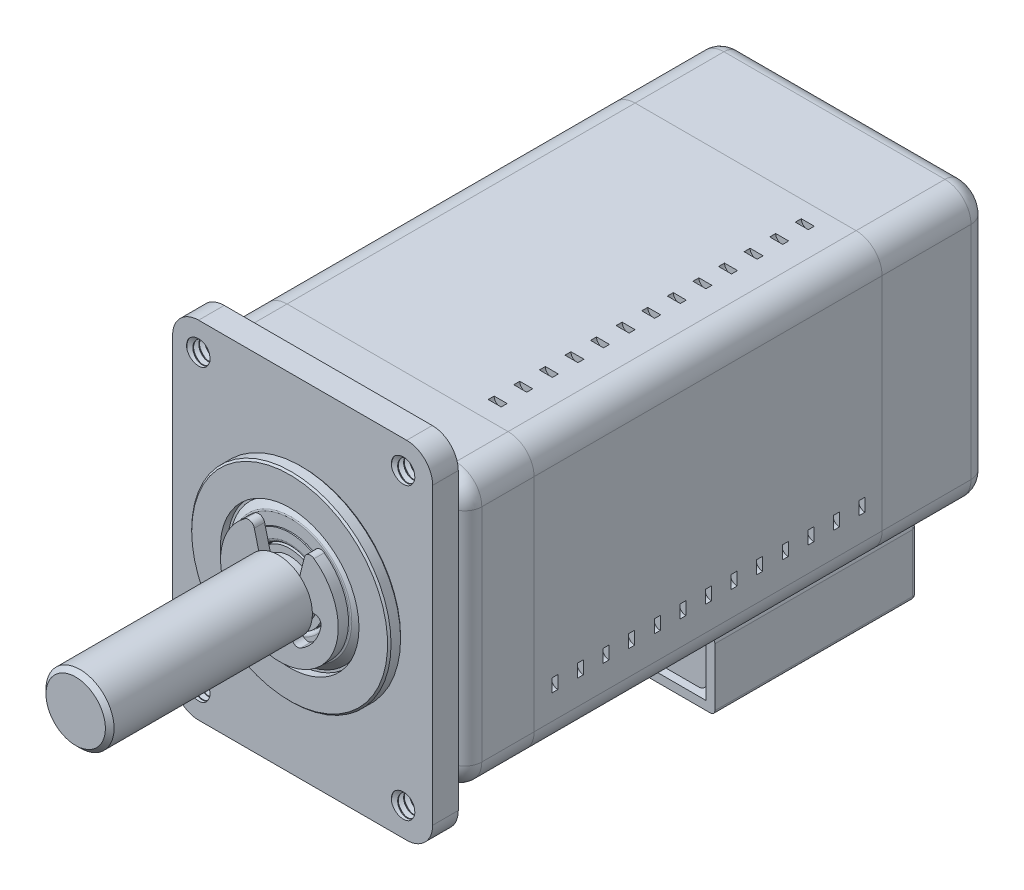
from build123d import *

# Parameters (mm, degrees)
SKETCH3_R                    = 0.8
SKETCH3_R_2                  = 5.08
BOSS_EXTRUDE1_DEPTH          = 1.5
SKETCH4_W                    = 4.064
SKETCH4_H                    = 0.762
CHAMFER1_SIZE                = 0.1016
FILLET1_R                    = 0.2032
FILLET2_R                    = 0.127
CHAMFER2_SIZE                = 0.254
BOSS_EXTRUDE2_DEPTH          = 0.59944
FILLET3_R                    = 0.36068
SKETCH9_W                    = 16
SKETCH9_H                    = 16
SKETCH9_R                    = 5.075
BOSS_EXTRUDE3_DEPTH          = 4.064
FILLET4_R                    = 1.524
FILLET5_R                    = 1
SKETCH10_R                   = 5.075
BOSS_EXTRUDE4_DEPTH          = 6.20776
FILLET6_R                    = 1
BOSS_EXTRUDE5_DEPTH          = 20.39424
CUT_EXTRUDE1_START           = -1
SKETCH13_R                   = 0.381
CUT_EXTRUDE1_DEPTH           = 0.35052
LPATTERN1_COUNT              = 13
LPATTERN1_PITCH              = 1.5
CIRPATTERN1_COUNT            = 4
CIRPATTERN1_START            = -1
CIRPATTERN1_COPY_1_SKETCH_R  = 0.381
CIRPATTERN1_COPY_1_DEPTH     = 0.35052
CIRPATTERN1_COPY_2_SKETCH_R  = 0.381
CIRPATTERN1_COPY_2_DEPTH     = 0.35052
CIRPATTERN1_COPY_3_SKETCH_R  = 0.381
CIRPATTERN1_COPY_3_DEPTH     = 0.35052
CIRPATTERN1_COPY_4_SKETCH_R  = 0.381
CIRPATTERN1_COPY_4_DEPTH     = 0.35052
CIRPATTERN1_COPY_5_SKETCH_R  = 0.381
CIRPATTERN1_COPY_5_DEPTH     = 0.35052
CIRPATTERN1_COPY_6_SKETCH_R  = 0.381
CIRPATTERN1_COPY_6_DEPTH     = 0.35052
CIRPATTERN1_COPY_7_SKETCH_R  = 0.381
CIRPATTERN1_COPY_7_DEPTH     = 0.35052
CIRPATTERN1_COPY_8_SKETCH_R  = 0.381
CIRPATTERN1_COPY_8_DEPTH     = 0.35052
CIRPATTERN1_COPY_9_SKETCH_R  = 0.381
CIRPATTERN1_COPY_9_DEPTH     = 0.35052
CIRPATTERN1_COPY_10_SKETCH_R = 0.381
CIRPATTERN1_COPY_10_DEPTH    = 0.35052
CIRPATTERN1_COPY_11_SKETCH_R = 0.381
CIRPATTERN1_COPY_11_DEPTH    = 0.35052
CIRPATTERN1_COPY_12_SKETCH_R = 0.381
CIRPATTERN1_COPY_12_DEPTH    = 0.35052
CIRPATTERN1_COPY_13_SKETCH_R = 0.381
CIRPATTERN1_COPY_13_DEPTH    = 0.35052
CIRPATTERN1_COPY_14_SKETCH_R = 0.381
CIRPATTERN1_COPY_14_DEPTH    = 0.35052
CIRPATTERN1_COPY_15_SKETCH_R = 0.381
CIRPATTERN1_COPY_15_DEPTH    = 0.35052
CIRPATTERN1_COPY_16_SKETCH_R = 0.381
CIRPATTERN1_COPY_16_DEPTH    = 0.35052
CIRPATTERN1_COPY_17_SKETCH_R = 0.381
CIRPATTERN1_COPY_17_DEPTH    = 0.35052
CIRPATTERN1_COPY_18_SKETCH_R = 0.381
CIRPATTERN1_COPY_18_DEPTH    = 0.35052
CIRPATTERN1_COPY_19_SKETCH_R = 0.381
CIRPATTERN1_COPY_19_DEPTH    = 0.35052
CIRPATTERN1_COPY_20_SKETCH_R = 0.381
CIRPATTERN1_COPY_20_DEPTH    = 0.35052
CIRPATTERN1_COPY_21_SKETCH_R = 0.381
CIRPATTERN1_COPY_21_DEPTH    = 0.35052
CIRPATTERN1_COPY_22_SKETCH_R = 0.381
CIRPATTERN1_COPY_22_DEPTH    = 0.35052
CIRPATTERN1_COPY_23_SKETCH_R = 0.381
CIRPATTERN1_COPY_23_DEPTH    = 0.35052
CIRPATTERN1_COPY_24_SKETCH_R = 0.381
CIRPATTERN1_COPY_24_DEPTH    = 0.35052
CIRPATTERN1_COPY_25_SKETCH_R = 0.381
CIRPATTERN1_COPY_25_DEPTH    = 0.35052
CIRPATTERN1_COPY_26_SKETCH_R = 0.381
CIRPATTERN1_COPY_26_DEPTH    = 0.35052
CIRPATTERN1_COPY_27_SKETCH_R = 0.381
CIRPATTERN1_COPY_27_DEPTH    = 0.35052
CIRPATTERN1_COPY_28_SKETCH_R = 0.381
CIRPATTERN1_COPY_28_DEPTH    = 0.35052
CIRPATTERN1_COPY_29_SKETCH_R = 0.381
CIRPATTERN1_COPY_29_DEPTH    = 0.35052
CIRPATTERN1_COPY_30_SKETCH_R = 0.381
CIRPATTERN1_COPY_30_DEPTH    = 0.35052
CIRPATTERN1_COPY_31_SKETCH_R = 0.381
CIRPATTERN1_COPY_31_DEPTH    = 0.35052
CIRPATTERN1_COPY_32_SKETCH_R = 0.381
CIRPATTERN1_COPY_32_DEPTH    = 0.35052
CIRPATTERN1_COPY_33_SKETCH_R = 0.381
CIRPATTERN1_COPY_33_DEPTH    = 0.35052
CIRPATTERN1_COPY_34_SKETCH_R = 0.381
CIRPATTERN1_COPY_34_DEPTH    = 0.35052
CIRPATTERN1_COPY_35_SKETCH_R = 0.381
CIRPATTERN1_COPY_35_DEPTH    = 0.35052
CIRPATTERN1_COPY_36_SKETCH_R = 0.381
CIRPATTERN1_COPY_36_DEPTH    = 0.35052
SKETCH14_R                   = 2.8575
BOSS_EXTRUDE7_DEPTH          = 0.508
SKETCH15_R                   = 2.25
BOSS_EXTRUDE8_DEPTH          = 1.53
CUT_EXTRUDE2_DEPTH           = 1.05
BOSS_EXTRUDE9_DEPTH          = 7.05
BOSS_EXTRUDE9_DEPTH_BACK     = 7.05
SKETCH19_W                   = 11.84828
SKETCH19_H                   = 3.9
SHELL1_T                     = -0.508
FILLET7_R                    = 0.254
SKETCH20_W                   = 9.017
SKETCH20_H                   = 0.508
CUT_EXTRUDE4_DEPTH           = 3.175
BOSS_EXTRUDE10_START         = -0.254
BOSS_EXTRUDE10_DEPTH         = 2.54
SKETCH22_R                   = 0.4826
BOSS_EXTRUDE11_DEPTH         = 3.81
BOSS_EXTRUDE11_2_DEPTH       = 3.81
BOSS_EXTRUDE11_3_DEPTH       = 3.81
BOSS_EXTRUDE11_4_DEPTH       = 3.81
SWEEP5_PITCH                 = 0.35
SWEEP5_HEIGHT                = 1.85
SWEEP5_RADIUS                = 0.8
SWEEP5_START_ANGLE           = 90
LPATTERN4_COUNT              = 2
LPATTERN4_PITCH              = 17
LPATTERN5_COUNT              = 2
LPATTERN5_PITCH              = 12
CUT_EXTRUDE5_DEPTH           = 38.791945742
CUT_EXTRUDE6_DEPTH           = 37.408558921


# Read off the part's stored shape, not the designer's step: Mirror1
with BuildPart() as part:
    # Sketch3 → Boss-Extrude1 (new body)
    with BuildSketch(Plane.XY.offset(9.433)):
        with BuildLine():
            Line((-6.096, 10.15), (6.096, 10.15))
            ThreePointArc((6.096, 10.15), (7.173630735, 9.703630735), (7.62, 8.626))
            Line((7.62, 8.626), (7.62, -8.626))
            ThreePointArc((7.62, -8.626), (7.173630735, -9.703630735), (6.096, -10.15))
            Line((6.096, -10.15), (-6.096, -10.15))
            ThreePointArc((-6.096, -10.15), (-7.173630735, -9.703630735), (-7.62, -8.626))
            Line((-7.62, -8.626), (-7.62, 8.626))
            ThreePointArc((-7.62, 8.626), (-7.173630735, 9.703630735), (-6.096, 10.15))
        make_face()
        with Locations((6, -8.5)):
            Circle(SKETCH3_R, mode=Mode.SUBTRACT)
        with Locations((6, 8.5)):
            Circle(SKETCH3_R, mode=Mode.SUBTRACT)
        with Locations((-6, 8.5)):
            Circle(SKETCH3_R, mode=Mode.SUBTRACT)
        with Locations((-6, -8.5)):
            Circle(SKETCH3_R, mode=Mode.SUBTRACT)
        Circle(SKETCH3_R_2, mode=Mode.SUBTRACT)
    extrude(amount=-BOSS_EXTRUDE1_DEPTH)


with BuildPart() as body_2:
    # Sketch4 → Revolve1 (revolve)
    with BuildSketch(Plane(origin=(0, 0, 0), x_dir=(0, 0, -1), z_dir=(1, 0, 0)), mode=Mode.PRIVATE) as revolve1_sk:
        Polygon((-6.131, 5.075), (-9.433, 5.075), (-9.433, 5.842), (-10.195, 5.842), (-10.195, 4.064), (-6.131, 4.064), align=None)
        with Locations((-8.163, 2.413)):
            Rectangle(SKETCH4_W, SKETCH4_H)
    revolve(revolve1_sk.sketch.rotate(Axis((0, 0, 22.733), (0, 0, -1)), 90), axis=Axis((0, 0, 22.733), (0, 0, -1)))

    # Chamfer1
    chamfer1_edges = [body_2.edges().sort_by_distance(p)[0] for p in [
        (-5.842, 0, 10.195),
        (-5.842, 0, 9.433),
    ]]
    chamfer(chamfer1_edges, length=CHAMFER1_SIZE)

    # Fillet1
    fillet1_edges = [body_2.edges().sort_by_distance(p)[0] for p in [
        (-2.032, 0, 10.195),
    ]]
    fillet(fillet1_edges, radius=FILLET1_R)


with BuildPart() as body_3:
    # Sketch5 → Revolve2 (revolve)
    with BuildSketch(Plane(origin=(0, 0, 0), x_dir=(0, 0, -1), z_dir=(1, 0, 0)), mode=Mode.PRIVATE) as revolve2_sk:
        Polygon((-10.1188, 3.50012), (-10.1188, 2.794), (-9.39236, 2.794), (-9.39236, 4.064), (-9.75558, 4.064), (-9.75558, 3.93298874), align=None)
    revolve(revolve2_sk.sketch.rotate(Axis((0, 0, 22.733), (0, 0, -1)), 90), axis=Axis((0, 0, 22.733), (0, 0, -1)))

    # Fillet2
    fillet2_edges = [body_3.edges().sort_by_distance(p)[0] for p in [
        (-3.50012, 0, 10.1188),
    ]]
    fillet(fillet2_edges, radius=FILLET2_R)


with BuildPart() as body_4:
    # Sketch6 → Revolve3 (revolve)
    with BuildSketch(Plane(origin=(0, 0, 0), x_dir=(0, 0, -1), z_dir=(1, 0, 0)), mode=Mode.PRIVATE) as revolve3_sk:
        Polygon((-22.733, 0), (-22.733, 1.994), (-10.8554, 1.994), (-10.8554, 1.613), (-10.195, 1.613), (-10.195, 1.994), (22.733, 1.994), (22.733, 0), align=None)
    revolve(revolve3_sk.sketch.rotate(Axis((0, 0, 22.733), (0, 0, -1)), 90), axis=Axis((0, 0, 22.733), (0, 0, -1)))

    # Chamfer2
    chamfer2_edges = [body_4.edges().sort_by_distance(p)[0] for p in [
        (-1.994, 0, -22.733),
        (-1.994, 0, 22.733),
    ]]
    chamfer(chamfer2_edges, length=CHAMFER2_SIZE)


with BuildPart() as body_5:
    # Sketch8 → Boss-Extrude2 (new body)
    with BuildSketch(Plane.XY.offset(10.195)):
        with BuildLine():
            ThreePointArc((-1.5875, 3.062295252), (0, -3.44932), (1.5875, 3.062295252))
            Line((1.5875, 3.062295252), (1.217677431, 1.579017946))
            ThreePointArc((1.217677431, 1.579017946), (1.789425159, 0.879769061), (1.994, 0))
            ThreePointArc((1.994, 0), (1.993999088, -0.001907133), (1.993996352, -0.003814265))
            Line((1.993996352, -0.003814265), (2.476484912, -0.008644598))
            ThreePointArc((2.476484912, -0.008644598), (2.032341842, -1.415146242), (0.86728858, -2.319668677))
            Line((0.86728858, -2.319668677), (0.698313518, -1.867724345))
            ThreePointArc((0.698313518, -1.867724345), (0, -1.994), (-0.698313518, -1.867724345))
            Line((-0.698313518, -1.867724345), (-0.86728858, -2.319668677))
            ThreePointArc((-0.86728858, -2.319668677), (-2.034808642, -1.411596983), (-2.4765, 0))
            Line((-2.4765, 0), (-1.994, 0))
            ThreePointArc((-1.994, 0), (-1.789425159, 0.879769061), (-1.217677431, 1.579017946))
            Line((-1.217677431, 1.579017946), (-1.5875, 3.062295252))
        make_face()
        with BuildLine():
            Line((-1.114670775, 1.16588081), (-1.217677431, 1.579017946))
            ThreePointArc((-1.217677431, 1.579017946), (-1.789425159, 0.879769061), (-1.994, 0))
            Line((-1.994, 0), (-1.613, 0))
            ThreePointArc((-1.613, 0), (-1.483194687, 0.633957822), (-1.114670775, 1.16588081))
        make_face()
        with BuildLine():
            ThreePointArc((-0.698313518, -1.867724345), (0, -1.994), (0.698313518, -1.867724345))
            Line((0.698313518, -1.867724345), (0.564884506, -1.510852241))
            ThreePointArc((0.564884506, -1.510852241), (0, -1.613), (-0.564884506, -1.510852241))
            Line((-0.564884506, -1.510852241), (-0.698313518, -1.867724345))
        make_face()
        with BuildLine():
            ThreePointArc((1.994, 0), (1.789425159, 0.879769061), (1.217677431, 1.579017946))
            Line((1.217677431, 1.579017946), (1.114670775, 1.16588081))
            ThreePointArc((1.114670775, 1.16588081), (1.483194687, 0.633957822), (1.613, 0))
            Line((1.613, 0), (1.993996352, -0.003814265))
            ThreePointArc((1.993996352, -0.003814265), (1.993999088, -0.001907133), (1.994, 0))
        make_face()
    extrude(amount=BOSS_EXTRUDE2_DEPTH)

    # Fillet3
    fillet3_edges = [body_5.edges().sort_by_distance(p)[0] for p in [
        (2.476484912, -0.008644598, 10.49472),
        (1.5875, 3.062295252, 10.49472),
        (-1.5875, 3.062295252, 10.49472),
        (-2.4765, 0, 10.49472),
        (-0.86728858, -2.319668677, 10.49472),
        (0.86728858, -2.319668677, 10.49472),
    ]]
    fillet(fillet3_edges, radius=FILLET3_R)


with BuildPart() as body_6:
    # Sketch9 → Boss-Extrude3 (new body)
    with BuildSketch(Plane(origin=(0, 0, 7.933), x_dir=(-1, 0, 0), z_dir=(0, 0, -1))):
        Rectangle(SKETCH9_W, SKETCH9_H)
        Circle(SKETCH9_R, mode=Mode.SUBTRACT)
    extrude(amount=BOSS_EXTRUDE3_DEPTH)

    # Fillet4
    fillet4_edges = [body_6.edges().sort_by_distance(p)[0] for p in [
        (8, -8, 5.901),
        (8, 8, 5.901),
        (-8, 8, 5.901),
        (-8, -8, 5.901),
    ]]
    fillet(fillet4_edges, radius=FILLET4_R)

    # Fillet5
    fillet5_edges = [body_6.edges().sort_by_distance(p)[0] for p in [
        (0, 8, 7.933),
        (0, -8, 7.933),
        (8, 0, 7.933),
        (-8, 0, 7.933),
        (7.553630735, -7.553630735, 7.933),
        (7.553630735, 7.553630735, 7.933),
        (-7.553630735, -7.553630735, 7.933),
        (-7.553630735, 7.553630735, 7.933),
    ]]
    fillet(fillet5_edges, radius=FILLET5_R)


with BuildPart() as body_7:
    # Sketch10 → Boss-Extrude4 (new body)
    with BuildSketch(Plane(origin=(0, 0, -22.733), x_dir=(-1, 0, 0), z_dir=(0, 0, -1))):
        with BuildLine():
            Line((8, -6.476), (8, 6.476))
            ThreePointArc((8, 6.476), (7.553630735, 7.553630735), (6.476, 8))
            Line((6.476, 8), (-6.476, 8))
            ThreePointArc((-6.476, 8), (-7.553630735, 7.553630735), (-8, 6.476))
            Line((-8, 6.476), (-8, -6.476))
            ThreePointArc((-8, -6.476), (-7.553630735, -7.553630735), (-6.476, -8))
            Line((-6.476, -8), (6.476, -8))
            ThreePointArc((6.476, -8), (7.553630735, -7.553630735), (8, -6.476))
        make_face()
        Circle(SKETCH10_R, mode=Mode.SUBTRACT)
    extrude(amount=-BOSS_EXTRUDE4_DEPTH)

    # Fillet6
    fillet6_edges = [body_7.edges().sort_by_distance(p)[0] for p in [
        (-8, 0, -22.733),
        (-7.553630735, -7.553630735, -22.733),
        (0, -8, -22.733),
        (7.553630735, -7.553630735, -22.733),
        (8, 0, -22.733),
        (7.553630735, 7.553630735, -22.733),
        (0, 8, -22.733),
        (-7.553630735, 7.553630735, -22.733),
    ]]
    fillet(fillet6_edges, radius=FILLET6_R)


with BuildPart() as body_8:
    # Mirror1 outline → Mirror1 (revolve)
    with BuildSketch(Plane.XZ):
        with BuildLine():
            ThreePointArc((2.032, -23.2918), (2.091515902, -23.435484098), (2.2352, -23.495))
            Line((2.2352, -23.495), (2.794, -23.495))
            Line((2.794, -23.495), (2.794, -19.431))
            Line((2.794, -19.431), (2.032, -19.431))
            Line((2.032, -19.431), (2.032, -23.2918))
        make_face()
    revolve(axis=Axis((0, 0, 0), (0, 0, 1)))


with BuildPart() as body_9:
    # Mirror1 2 outline → Mirror1 2 (revolve)
    with BuildSketch(Plane.XZ):
        with BuildLine():
            ThreePointArc((3.45389578, -23.4188), (3.497332339, -23.411140963), (3.535529807, -23.389087644))
            Line((3.535529807, -23.389087644), (3.93298874, -23.05558))
            Line((3.93298874, -23.05558), (4.064, -23.05558))
            Line((4.064, -23.05558), (4.064, -22.69236))
            Line((4.064, -22.69236), (2.794, -22.69236))
            Line((2.794, -22.69236), (2.794, -23.4188))
            Line((2.794, -23.4188), (3.45389578, -23.4188))
        make_face()
    revolve(axis=Axis((0, 0, 0), (0, 0, 1)))


with BuildPart() as body_10:
    # Mirror1 3 outline → Mirror1 3 (revolve)
    with BuildSketch(Plane.XZ):
        Polygon((5.075, -19.431), (4.064, -19.431), (4.064, -23.495), (5.7404, -23.495), (5.842, -23.3934), (5.842, -22.8346), (5.7404, -22.733), (5.075, -22.733), align=None)
    revolve(axis=Axis((0, 0, 0), (0, 0, 1)))


with BuildPart() as body_11:
    # Sketch11 → Boss-Extrude5 (new body)
    with BuildSketch(Plane(origin=(0, 0, 3.869), x_dir=(-1, 0, 0), z_dir=(0, 0, -1))):
        with BuildLine():
            Line((8, -6.476), (8, 6.476))
            ThreePointArc((8, 6.476), (7.553630735, 7.553630735), (6.476, 8))
            Line((6.476, 8), (-6.476, 8))
            ThreePointArc((-6.476, 8), (-7.553630735, 7.553630735), (-8, 6.476))
            Line((-8, 6.476), (-8, -6.476))
            ThreePointArc((-8, -6.476), (-7.553630735, -7.553630735), (-6.476, -8))
            Line((-6.476, -8), (6.476, -8))
            ThreePointArc((6.476, -8), (7.553630735, -7.553630735), (8, -6.476))
        make_face()
    extrude(amount=BOSS_EXTRUDE5_DEPTH)

    # Sketch13 → Cut-Extrude1 (cut)
    with BuildSketch(Plane(origin=(0, 0, -16.52524), x_dir=(-1, 0, 0), z_dir=(0, 0, -1)).offset(CUT_EXTRUDE1_START)):
        with Locations((-8, -4.64466)):
            Circle(SKETCH13_R)
    cut_extrude1 = extrude(amount=-CUT_EXTRUDE1_DEPTH, mode=Mode.SUBTRACT)

    # LPattern1: Cut-Extrude1 ×13
    with Locations(*[(0, 0, i * LPATTERN1_PITCH) for i in range(1, LPATTERN1_COUNT)]):
        add(cut_extrude1, mode=Mode.SUBTRACT)

    # CirPattern1: Cut-Extrude1 ×4 about axis
    cirpattern1_axis = Axis((0, 0, 0), (0, 0, 1))
    for i in range(1, CIRPATTERN1_COUNT):
        add(cut_extrude1.rotate(cirpattern1_axis, i * 360 / CIRPATTERN1_COUNT), mode=Mode.SUBTRACT)

    # CirPattern1 copy 1 sketch → CirPattern1 copy 1 (cut)
    with BuildSketch(Plane(origin=(0, 0, -15.02524), x_dir=(0, -1, 0), z_dir=(0, 0, -1)).offset(CIRPATTERN1_START)):
        with Locations((-8, -4.64466)):
            Circle(CIRPATTERN1_COPY_1_SKETCH_R)
    extrude(amount=-CIRPATTERN1_COPY_1_DEPTH, mode=Mode.SUBTRACT)

    # CirPattern1 copy 2 sketch → CirPattern1 copy 2 (cut)
    with BuildSketch(Plane(origin=(0, 0, -15.02524), x_dir=(1, 0, 0), z_dir=(0, 0, -1)).offset(CIRPATTERN1_START)):
        with Locations((-8, -4.64466)):
            Circle(CIRPATTERN1_COPY_2_SKETCH_R)
    extrude(amount=-CIRPATTERN1_COPY_2_DEPTH, mode=Mode.SUBTRACT)

    # CirPattern1 copy 3 sketch → CirPattern1 copy 3 (cut)
    with BuildSketch(Plane.YX.offset(15.02524).offset(CIRPATTERN1_START)):
        with Locations((-8, -4.64466)):
            Circle(CIRPATTERN1_COPY_3_SKETCH_R)
    extrude(amount=-CIRPATTERN1_COPY_3_DEPTH, mode=Mode.SUBTRACT)

    # CirPattern1 copy 4 sketch → CirPattern1 copy 4 (cut)
    with BuildSketch(Plane(origin=(0, 0, -13.52524), x_dir=(0, -1, 0), z_dir=(0, 0, -1)).offset(CIRPATTERN1_START)):
        with Locations((-8, -4.64466)):
            Circle(CIRPATTERN1_COPY_4_SKETCH_R)
    extrude(amount=-CIRPATTERN1_COPY_4_DEPTH, mode=Mode.SUBTRACT)

    # CirPattern1 copy 5 sketch → CirPattern1 copy 5 (cut)
    with BuildSketch(Plane(origin=(0, 0, -13.52524), x_dir=(1, 0, 0), z_dir=(0, 0, -1)).offset(CIRPATTERN1_START)):
        with Locations((-8, -4.64466)):
            Circle(CIRPATTERN1_COPY_5_SKETCH_R)
    extrude(amount=-CIRPATTERN1_COPY_5_DEPTH, mode=Mode.SUBTRACT)

    # CirPattern1 copy 6 sketch → CirPattern1 copy 6 (cut)
    with BuildSketch(Plane.YX.offset(13.52524).offset(CIRPATTERN1_START)):
        with Locations((-8, -4.64466)):
            Circle(CIRPATTERN1_COPY_6_SKETCH_R)
    extrude(amount=-CIRPATTERN1_COPY_6_DEPTH, mode=Mode.SUBTRACT)

    # CirPattern1 copy 7 sketch → CirPattern1 copy 7 (cut)
    with BuildSketch(Plane(origin=(0, 0, -12.02524), x_dir=(0, -1, 0), z_dir=(0, 0, -1)).offset(CIRPATTERN1_START)):
        with Locations((-8, -4.64466)):
            Circle(CIRPATTERN1_COPY_7_SKETCH_R)
    extrude(amount=-CIRPATTERN1_COPY_7_DEPTH, mode=Mode.SUBTRACT)

    # CirPattern1 copy 8 sketch → CirPattern1 copy 8 (cut)
    with BuildSketch(Plane(origin=(0, 0, -12.02524), x_dir=(1, 0, 0), z_dir=(0, 0, -1)).offset(CIRPATTERN1_START)):
        with Locations((-8, -4.64466)):
            Circle(CIRPATTERN1_COPY_8_SKETCH_R)
    extrude(amount=-CIRPATTERN1_COPY_8_DEPTH, mode=Mode.SUBTRACT)

    # CirPattern1 copy 9 sketch → CirPattern1 copy 9 (cut)
    with BuildSketch(Plane.YX.offset(12.02524).offset(CIRPATTERN1_START)):
        with Locations((-8, -4.64466)):
            Circle(CIRPATTERN1_COPY_9_SKETCH_R)
    extrude(amount=-CIRPATTERN1_COPY_9_DEPTH, mode=Mode.SUBTRACT)

    # CirPattern1 copy 10 sketch → CirPattern1 copy 10 (cut)
    with BuildSketch(Plane(origin=(0, 0, -10.52524), x_dir=(0, -1, 0), z_dir=(0, 0, -1)).offset(CIRPATTERN1_START)):
        with Locations((-8, -4.64466)):
            Circle(CIRPATTERN1_COPY_10_SKETCH_R)
    extrude(amount=-CIRPATTERN1_COPY_10_DEPTH, mode=Mode.SUBTRACT)

    # CirPattern1 copy 11 sketch → CirPattern1 copy 11 (cut)
    with BuildSketch(Plane(origin=(0, 0, -10.52524), x_dir=(1, 0, 0), z_dir=(0, 0, -1)).offset(CIRPATTERN1_START)):
        with Locations((-8, -4.64466)):
            Circle(CIRPATTERN1_COPY_11_SKETCH_R)
    extrude(amount=-CIRPATTERN1_COPY_11_DEPTH, mode=Mode.SUBTRACT)

    # CirPattern1 copy 12 sketch → CirPattern1 copy 12 (cut)
    with BuildSketch(Plane.YX.offset(10.52524).offset(CIRPATTERN1_START)):
        with Locations((-8, -4.64466)):
            Circle(CIRPATTERN1_COPY_12_SKETCH_R)
    extrude(amount=-CIRPATTERN1_COPY_12_DEPTH, mode=Mode.SUBTRACT)

    # CirPattern1 copy 13 sketch → CirPattern1 copy 13 (cut)
    with BuildSketch(Plane(origin=(0, 0, -9.02524), x_dir=(0, -1, 0), z_dir=(0, 0, -1)).offset(CIRPATTERN1_START)):
        with Locations((-8, -4.64466)):
            Circle(CIRPATTERN1_COPY_13_SKETCH_R)
    extrude(amount=-CIRPATTERN1_COPY_13_DEPTH, mode=Mode.SUBTRACT)

    # CirPattern1 copy 14 sketch → CirPattern1 copy 14 (cut)
    with BuildSketch(Plane(origin=(0, 0, -9.02524), x_dir=(1, 0, 0), z_dir=(0, 0, -1)).offset(CIRPATTERN1_START)):
        with Locations((-8, -4.64466)):
            Circle(CIRPATTERN1_COPY_14_SKETCH_R)
    extrude(amount=-CIRPATTERN1_COPY_14_DEPTH, mode=Mode.SUBTRACT)

    # CirPattern1 copy 15 sketch → CirPattern1 copy 15 (cut)
    with BuildSketch(Plane.YX.offset(9.02524).offset(CIRPATTERN1_START)):
        with Locations((-8, -4.64466)):
            Circle(CIRPATTERN1_COPY_15_SKETCH_R)
    extrude(amount=-CIRPATTERN1_COPY_15_DEPTH, mode=Mode.SUBTRACT)

    # CirPattern1 copy 16 sketch → CirPattern1 copy 16 (cut)
    with BuildSketch(Plane(origin=(0, 0, -7.52524), x_dir=(0, -1, 0), z_dir=(0, 0, -1)).offset(CIRPATTERN1_START)):
        with Locations((-8, -4.64466)):
            Circle(CIRPATTERN1_COPY_16_SKETCH_R)
    extrude(amount=-CIRPATTERN1_COPY_16_DEPTH, mode=Mode.SUBTRACT)

    # CirPattern1 copy 17 sketch → CirPattern1 copy 17 (cut)
    with BuildSketch(Plane(origin=(0, 0, -7.52524), x_dir=(1, 0, 0), z_dir=(0, 0, -1)).offset(CIRPATTERN1_START)):
        with Locations((-8, -4.64466)):
            Circle(CIRPATTERN1_COPY_17_SKETCH_R)
    extrude(amount=-CIRPATTERN1_COPY_17_DEPTH, mode=Mode.SUBTRACT)

    # CirPattern1 copy 18 sketch → CirPattern1 copy 18 (cut)
    with BuildSketch(Plane.YX.offset(7.52524).offset(CIRPATTERN1_START)):
        with Locations((-8, -4.64466)):
            Circle(CIRPATTERN1_COPY_18_SKETCH_R)
    extrude(amount=-CIRPATTERN1_COPY_18_DEPTH, mode=Mode.SUBTRACT)

    # CirPattern1 copy 19 sketch → CirPattern1 copy 19 (cut)
    with BuildSketch(Plane(origin=(0, 0, -6.02524), x_dir=(0, -1, 0), z_dir=(0, 0, -1)).offset(CIRPATTERN1_START)):
        with Locations((-8, -4.64466)):
            Circle(CIRPATTERN1_COPY_19_SKETCH_R)
    extrude(amount=-CIRPATTERN1_COPY_19_DEPTH, mode=Mode.SUBTRACT)

    # CirPattern1 copy 20 sketch → CirPattern1 copy 20 (cut)
    with BuildSketch(Plane(origin=(0, 0, -6.02524), x_dir=(1, 0, 0), z_dir=(0, 0, -1)).offset(CIRPATTERN1_START)):
        with Locations((-8, -4.64466)):
            Circle(CIRPATTERN1_COPY_20_SKETCH_R)
    extrude(amount=-CIRPATTERN1_COPY_20_DEPTH, mode=Mode.SUBTRACT)

    # CirPattern1 copy 21 sketch → CirPattern1 copy 21 (cut)
    with BuildSketch(Plane.YX.offset(6.02524).offset(CIRPATTERN1_START)):
        with Locations((-8, -4.64466)):
            Circle(CIRPATTERN1_COPY_21_SKETCH_R)
    extrude(amount=-CIRPATTERN1_COPY_21_DEPTH, mode=Mode.SUBTRACT)

    # CirPattern1 copy 22 sketch → CirPattern1 copy 22 (cut)
    with BuildSketch(Plane(origin=(0, 0, -4.52524), x_dir=(0, -1, 0), z_dir=(0, 0, -1)).offset(CIRPATTERN1_START)):
        with Locations((-8, -4.64466)):
            Circle(CIRPATTERN1_COPY_22_SKETCH_R)
    extrude(amount=-CIRPATTERN1_COPY_22_DEPTH, mode=Mode.SUBTRACT)

    # CirPattern1 copy 23 sketch → CirPattern1 copy 23 (cut)
    with BuildSketch(Plane(origin=(0, 0, -4.52524), x_dir=(1, 0, 0), z_dir=(0, 0, -1)).offset(CIRPATTERN1_START)):
        with Locations((-8, -4.64466)):
            Circle(CIRPATTERN1_COPY_23_SKETCH_R)
    extrude(amount=-CIRPATTERN1_COPY_23_DEPTH, mode=Mode.SUBTRACT)

    # CirPattern1 copy 24 sketch → CirPattern1 copy 24 (cut)
    with BuildSketch(Plane.YX.offset(4.52524).offset(CIRPATTERN1_START)):
        with Locations((-8, -4.64466)):
            Circle(CIRPATTERN1_COPY_24_SKETCH_R)
    extrude(amount=-CIRPATTERN1_COPY_24_DEPTH, mode=Mode.SUBTRACT)

    # CirPattern1 copy 25 sketch → CirPattern1 copy 25 (cut)
    with BuildSketch(Plane(origin=(0, 0, -3.02524), x_dir=(0, -1, 0), z_dir=(0, 0, -1)).offset(CIRPATTERN1_START)):
        with Locations((-8, -4.64466)):
            Circle(CIRPATTERN1_COPY_25_SKETCH_R)
    extrude(amount=-CIRPATTERN1_COPY_25_DEPTH, mode=Mode.SUBTRACT)

    # CirPattern1 copy 26 sketch → CirPattern1 copy 26 (cut)
    with BuildSketch(Plane(origin=(0, 0, -3.02524), x_dir=(1, 0, 0), z_dir=(0, 0, -1)).offset(CIRPATTERN1_START)):
        with Locations((-8, -4.64466)):
            Circle(CIRPATTERN1_COPY_26_SKETCH_R)
    extrude(amount=-CIRPATTERN1_COPY_26_DEPTH, mode=Mode.SUBTRACT)

    # CirPattern1 copy 27 sketch → CirPattern1 copy 27 (cut)
    with BuildSketch(Plane.YX.offset(3.02524).offset(CIRPATTERN1_START)):
        with Locations((-8, -4.64466)):
            Circle(CIRPATTERN1_COPY_27_SKETCH_R)
    extrude(amount=-CIRPATTERN1_COPY_27_DEPTH, mode=Mode.SUBTRACT)

    # CirPattern1 copy 28 sketch → CirPattern1 copy 28 (cut)
    with BuildSketch(Plane(origin=(0, 0, -1.52524), x_dir=(0, -1, 0), z_dir=(0, 0, -1)).offset(CIRPATTERN1_START)):
        with Locations((-8, -4.64466)):
            Circle(CIRPATTERN1_COPY_28_SKETCH_R)
    extrude(amount=-CIRPATTERN1_COPY_28_DEPTH, mode=Mode.SUBTRACT)

    # CirPattern1 copy 29 sketch → CirPattern1 copy 29 (cut)
    with BuildSketch(Plane(origin=(0, 0, -1.52524), x_dir=(1, 0, 0), z_dir=(0, 0, -1)).offset(CIRPATTERN1_START)):
        with Locations((-8, -4.64466)):
            Circle(CIRPATTERN1_COPY_29_SKETCH_R)
    extrude(amount=-CIRPATTERN1_COPY_29_DEPTH, mode=Mode.SUBTRACT)

    # CirPattern1 copy 30 sketch → CirPattern1 copy 30 (cut)
    with BuildSketch(Plane.YX.offset(1.52524).offset(CIRPATTERN1_START)):
        with Locations((-8, -4.64466)):
            Circle(CIRPATTERN1_COPY_30_SKETCH_R)
    extrude(amount=-CIRPATTERN1_COPY_30_DEPTH, mode=Mode.SUBTRACT)

    # CirPattern1 copy 31 sketch → CirPattern1 copy 31 (cut)
    with BuildSketch(Plane(origin=(0, 0, -0.02524), x_dir=(0, -1, 0), z_dir=(0, 0, -1)).offset(CIRPATTERN1_START)):
        with Locations((-8, -4.64466)):
            Circle(CIRPATTERN1_COPY_31_SKETCH_R)
    extrude(amount=-CIRPATTERN1_COPY_31_DEPTH, mode=Mode.SUBTRACT)

    # CirPattern1 copy 32 sketch → CirPattern1 copy 32 (cut)
    with BuildSketch(Plane(origin=(0, 0, -0.02524), x_dir=(1, 0, 0), z_dir=(0, 0, -1)).offset(CIRPATTERN1_START)):
        with Locations((-8, -4.64466)):
            Circle(CIRPATTERN1_COPY_32_SKETCH_R)
    extrude(amount=-CIRPATTERN1_COPY_32_DEPTH, mode=Mode.SUBTRACT)

    # CirPattern1 copy 33 sketch → CirPattern1 copy 33 (cut)
    with BuildSketch(Plane.YX.offset(0.02524).offset(CIRPATTERN1_START)):
        with Locations((-8, -4.64466)):
            Circle(CIRPATTERN1_COPY_33_SKETCH_R)
    extrude(amount=-CIRPATTERN1_COPY_33_DEPTH, mode=Mode.SUBTRACT)

    # CirPattern1 copy 34 sketch → CirPattern1 copy 34 (cut)
    with BuildSketch(Plane(origin=(0, 0, 1.47476), x_dir=(0, -1, 0), z_dir=(0, 0, -1)).offset(CIRPATTERN1_START)):
        with Locations((-8, -4.64466)):
            Circle(CIRPATTERN1_COPY_34_SKETCH_R)
    extrude(amount=-CIRPATTERN1_COPY_34_DEPTH, mode=Mode.SUBTRACT)

    # CirPattern1 copy 35 sketch → CirPattern1 copy 35 (cut)
    with BuildSketch(Plane(origin=(0, 0, 1.47476), x_dir=(1, 0, 0), z_dir=(0, 0, -1)).offset(CIRPATTERN1_START)):
        with Locations((-8, -4.64466)):
            Circle(CIRPATTERN1_COPY_35_SKETCH_R)
    extrude(amount=-CIRPATTERN1_COPY_35_DEPTH, mode=Mode.SUBTRACT)

    # CirPattern1 copy 36 sketch → CirPattern1 copy 36 (cut)
    with BuildSketch(Plane.YX.offset(-1.47476).offset(CIRPATTERN1_START)):
        with Locations((-8, -4.64466)):
            Circle(CIRPATTERN1_COPY_36_SKETCH_R)
    extrude(amount=-CIRPATTERN1_COPY_36_DEPTH, mode=Mode.SUBTRACT)


with BuildPart() as body_12:
    # Sketch14 → Boss-Extrude7 (new body)
    with BuildSketch(Plane(origin=(0, 0, -23.495), x_dir=(-1, 0, 0), z_dir=(0, 0, -1))):
        Circle(SKETCH14_R)
    extrude(amount=BOSS_EXTRUDE7_DEPTH)


with BuildPart() as body_13:
    # Sketch15 → Boss-Extrude8 (new body)
    with BuildSketch(Plane(origin=(0, 0, -24.003), x_dir=(-1, 0, 0), z_dir=(0, 0, -1))):
        Circle(SKETCH15_R)
    extrude(amount=BOSS_EXTRUDE8_DEPTH)

    # Sketch16 → Cut-Revolve1 (revolve, cut)
    with BuildSketch(Plane(origin=(0, 0, 0), x_dir=(0, 0, -1), z_dir=(1, 0, 0)), mode=Mode.PRIVATE) as cut_revolve1_sk:
        with BuildLine():
            Line((24.228, 2.25), (25.533, 2.25))
            Line((25.533, 2.25), (25.533, 1.24968))
            ThreePointArc((25.533, 1.24968), (24.970140979, 1.866784056), (24.228, 2.25))
        make_face()
    revolve(cut_revolve1_sk.sketch.rotate(Axis((0, 0, -22.733), (0, 0, -1)), 270), axis=Axis((0, 0, -22.733), (0, 0, -1)), mode=Mode.SUBTRACT)

    # Sketch17 → Cut-Extrude2 (cut)
    with BuildSketch(Plane(origin=(0, 0, -25.533), x_dir=(-1, 0, 0), z_dir=(0, 0, -1))):
        Polygon((0, 0.866025404), (-0.75, 0.433012702), (-0.75, -0.433012702), (0, -0.866025404), (0.75, -0.433012702), (0.75, 0.433012702), align=None)
    extrude(amount=-CUT_EXTRUDE2_DEPTH, mode=Mode.SUBTRACT)

    # Cut-Extrude3 cone 1 section (through the dimple's axis) → Cut-Extrude3 (revolve, cut)
    with BuildSketch(Plane(origin=(0, 0, -25.533), x_dir=(0, 1, 0), z_dir=(1, 0, 0))):
        Polygon((0, 0), (0.866025404, 0), (0, 0.866025404), align=None)
    revolve(axis=Axis((0, 0, -25.533), (0, 0, 1)), mode=Mode.SUBTRACT)


with BuildPart() as body_14:
    # Sketch19 → Boss-Extrude9 (new, two sides: drawn at the far end of the back side and taken through both)
    with BuildSketch(Plane(origin=(0, 0, 0), x_dir=(0, 0, -1), z_dir=(1, 0, 0)).offset(-BOSS_EXTRUDE9_DEPTH_BACK)):
        with Locations((13.59886, -9.95)):
            Rectangle(SKETCH19_W, SKETCH19_H)
    extrude(amount=BOSS_EXTRUDE9_DEPTH + BOSS_EXTRUDE9_DEPTH_BACK)

    # Shell1
    shell1_openings = [body_14.faces().sort_by_distance(p)[0] for p in [
        (0, -9.95, -7.67472),
    ]]
    offset(amount=SHELL1_T, openings=shell1_openings, kind=Kind.INTERSECTION)

    # Fillet7
    fillet7_edges = [body_14.edges().sort_by_distance(p)[0] for p in [
        (-7.05, -9.95, -19.523),
        (7.05, -11.9, -13.59886),
        (-7.05, -8, -13.59886),
        (7.05, -9.95, -19.523),
        (7.05, -8, -13.59886),
        (-7.05, -11.9, -13.59886),
        (0, -8, -19.523),
        (0, -11.9, -19.523),
    ]]
    fillet(fillet7_edges, radius=FILLET7_R)

    # Sketch20 → Cut-Extrude4 (cut)
    with BuildSketch(Plane.XY.offset(-7.67472)):
        with Locations((0, -8.254)):
            Rectangle(SKETCH20_W, SKETCH20_H)
    extrude(amount=-CUT_EXTRUDE4_DEPTH, mode=Mode.SUBTRACT)


with BuildPart() as body_15:
    # Sketch21 → Boss-Extrude10 (new body)
    with BuildSketch(Plane.XY.offset(-7.67472).offset(BOSS_EXTRUDE10_START)):
        with BuildLine():
            Line((-3.81, -8), (-3.81, -8.127))
            ThreePointArc((-3.81, -8.127), (-3.958789755, -8.486210245), (-4.318, -8.635))
            Line((-4.318, -8.635), (-4.5085, -8.635))
            Line((-4.5085, -8.635), (-5.842, -8.635))
            ThreePointArc((-5.842, -8.635), (-6.201210245, -8.783789755), (-6.35, -9.143))
            Line((-6.35, -9.143), (-6.35, -10.667))
            ThreePointArc((-6.35, -10.667), (-6.201210245, -11.026210245), (-5.842, -11.175))
            Line((-5.842, -11.175), (-3.961794895, -11.175))
            ThreePointArc((-3.961794895, -11.175), (-3.593713926, -11.027646578), (-3.429, -10.667))
            Line((-3.429, -10.667), (-3.6068, -10.667))
            ThreePointArc((-3.6068, -10.667), (-3.696602561, -10.629802561), (-3.7338, -10.54))
            Line((-3.7338, -10.54), (-3.7338, -10.3876))
            ThreePointArc((-3.7338, -10.3876), (-3.696602561, -10.297797439), (-3.6068, -10.2606))
            Line((-3.6068, -10.2606), (-3.410784564, -10.2606))
            ThreePointArc((-3.410784564, -10.2606), (-3.048, -9.397), (-2.685215436, -10.2606))
            Line((-2.685215436, -10.2606), (-2.4892, -10.2606))
            ThreePointArc((-2.4892, -10.2606), (-2.399397439, -10.297797439), (-2.3622, -10.3876))
            Line((-2.3622, -10.3876), (-2.3622, -10.54))
            ThreePointArc((-2.3622, -10.54), (-2.399397439, -10.629802561), (-2.4892, -10.667))
            Line((-2.4892, -10.667), (-2.667, -10.667))
            ThreePointArc((-2.667, -10.667), (-2.502286074, -11.027646578), (-2.134205105, -11.175))
            Line((-2.134205105, -11.175), (-1.929794895, -11.175))
            ThreePointArc((-1.929794895, -11.175), (-1.561713926, -11.027646578), (-1.397, -10.667))
            Line((-1.397, -10.667), (-1.5748, -10.667))
            ThreePointArc((-1.5748, -10.667), (-1.664602561, -10.629802561), (-1.7018, -10.54))
            Line((-1.7018, -10.54), (-1.7018, -10.3876))
            ThreePointArc((-1.7018, -10.3876), (-1.664602561, -10.297797439), (-1.5748, -10.2606))
            Line((-1.5748, -10.2606), (-1.378784564, -10.2606))
            ThreePointArc((-1.378784564, -10.2606), (-1.016, -9.397), (-0.653215436, -10.2606))
            Line((-0.653215436, -10.2606), (-0.4572, -10.2606))
            ThreePointArc((-0.4572, -10.2606), (-0.367397439, -10.297797439), (-0.3302, -10.3876))
            Line((-0.3302, -10.3876), (-0.3302, -10.54))
            ThreePointArc((-0.3302, -10.54), (-0.367397439, -10.629802561), (-0.4572, -10.667))
            Line((-0.4572, -10.667), (-0.635, -10.667))
            ThreePointArc((-0.635, -10.667), (-0.470286074, -11.027646578), (-0.102205105, -11.175))
            Line((-0.102205105, -11.175), (0.102205105, -11.175))
            ThreePointArc((0.102205105, -11.175), (0.470286074, -11.027646578), (0.635, -10.667))
            Line((0.635, -10.667), (0.4572, -10.667))
            ThreePointArc((0.4572, -10.667), (0.367397439, -10.629802561), (0.3302, -10.54))
            Line((0.3302, -10.54), (0.3302, -10.3876))
            ThreePointArc((0.3302, -10.3876), (0.367397439, -10.297797439), (0.4572, -10.2606))
            Line((0.4572, -10.2606), (0.653215436, -10.2606))
            ThreePointArc((0.653215436, -10.2606), (1.016, -9.397), (1.378784564, -10.2606))
            Line((1.378784564, -10.2606), (1.5748, -10.2606))
            ThreePointArc((1.5748, -10.2606), (1.664602561, -10.297797439), (1.7018, -10.3876))
            Line((1.7018, -10.3876), (1.7018, -10.54))
            ThreePointArc((1.7018, -10.54), (1.664602561, -10.629802561), (1.5748, -10.667))
            Line((1.5748, -10.667), (1.397, -10.667))
            ThreePointArc((1.397, -10.667), (1.561713926, -11.027646578), (1.929794895, -11.175))
            Line((1.929794895, -11.175), (2.134205105, -11.175))
            ThreePointArc((2.134205105, -11.175), (2.502286074, -11.027646578), (2.667, -10.667))
            Line((2.667, -10.667), (2.4892, -10.667))
            ThreePointArc((2.4892, -10.667), (2.399397439, -10.629802561), (2.3622, -10.54))
            Line((2.3622, -10.54), (2.3622, -10.3876))
            ThreePointArc((2.3622, -10.3876), (2.399397439, -10.297797439), (2.4892, -10.2606))
            Line((2.4892, -10.2606), (2.685215436, -10.2606))
            ThreePointArc((2.685215436, -10.2606), (3.048, -9.397), (3.410784564, -10.2606))
            Line((3.410784564, -10.2606), (3.6068, -10.2606))
            ThreePointArc((3.6068, -10.2606), (3.696602561, -10.297797439), (3.7338, -10.3876))
            Line((3.7338, -10.3876), (3.7338, -10.54))
            ThreePointArc((3.7338, -10.54), (3.696602561, -10.629802561), (3.6068, -10.667))
            Line((3.6068, -10.667), (3.429, -10.667))
            ThreePointArc((3.429, -10.667), (3.593713926, -11.027646578), (3.961794895, -11.175))
            Line((3.961794895, -11.175), (5.842, -11.175))
            ThreePointArc((5.842, -11.175), (6.201210245, -11.026210245), (6.35, -10.667))
            Line((6.35, -10.667), (6.35, -9.143))
            ThreePointArc((6.35, -9.143), (6.201210245, -8.783789755), (5.842, -8.635))
            Line((5.842, -8.635), (4.5085, -8.635))
            Line((4.5085, -8.635), (4.318, -8.635))
            ThreePointArc((4.318, -8.635), (3.958789755, -8.486210245), (3.81, -8.127))
            Line((3.81, -8.127), (3.81, -8))
            Line((3.81, -8), (-3.81, -8))
        make_face()
    extrude(amount=-BOSS_EXTRUDE10_DEPTH)


with BuildPart() as body_16:
    # Sketch22 → Boss-Extrude11 (new body)
    with BuildSketch(Plane(origin=(0, 0, -10.46872), x_dir=(-1, 0, 0), z_dir=(0, 0, -1))):
        with Locations((-3.048, -9.905)):
            Circle(SKETCH22_R)
    extrude(amount=-BOSS_EXTRUDE11_DEPTH)


with BuildPart() as body_17:
    # Sketch22 → Boss-Extrude11 2 (new body)
    with BuildSketch(Plane(origin=(0, 0, -10.46872), x_dir=(-1, 0, 0), z_dir=(0, 0, -1))):
        with Locations((-1.016, -9.905)):
            Circle(SKETCH22_R)
    extrude(amount=-BOSS_EXTRUDE11_2_DEPTH)


with BuildPart() as body_18:
    # Sketch22 → Boss-Extrude11 3 (new body)
    with BuildSketch(Plane(origin=(0, 0, -10.46872), x_dir=(-1, 0, 0), z_dir=(0, 0, -1))):
        with Locations((1.016, -9.905)):
            Circle(SKETCH22_R)
    extrude(amount=-BOSS_EXTRUDE11_3_DEPTH)


with BuildPart() as body_19:
    # Sketch22 → Boss-Extrude11 4 (new body)
    with BuildSketch(Plane(origin=(0, 0, -10.46872), x_dir=(-1, 0, 0), z_dir=(0, 0, -1))):
        with Locations((3.048, -9.905)):
            Circle(SKETCH22_R)
    extrude(amount=-BOSS_EXTRUDE11_4_DEPTH)


with BuildPart() as body_20:
    # Sweep5: sweep along a helix
    with BuildLine() as sweep5_path:
        add(Helix(SWEEP5_PITCH, SWEEP5_HEIGHT, SWEEP5_RADIUS, center=(6, 8.5, 7.933), direction=(0, 0, 1), mode=Mode.PRIVATE).rotate(Axis((6, 8.5, 7.933), (0, 0, 1)), SWEEP5_START_ANGLE))
    # Sketch35 → Sweep5 (sweep)
    with BuildSketch(Plane(origin=(6, 0, 0), x_dir=(0, 0, -1), z_dir=(1, 0, 0))):
        Polygon((-7.9439375, 9.318944306), (-7.80175, 9.072668332), (-7.758, 9.072668332), (-7.6158125, 9.318944306), align=None)
    sweep(path=sweep5_path.line, is_frenet=True)


with BuildPart() as lpattern4_1:
    # LPattern4: pattern copy
    add(body_20.part.moved(Location(Vector(0, -1, 0) * (1 * LPATTERN4_PITCH))))


with BuildPart() as lpattern5_1:
    # LPattern5: pattern copy
    add(lpattern4_1.part.moved(Location(Vector(-1, 0, 0) * (1 * LPATTERN5_PITCH))))


with BuildPart() as lpattern5_2:
    # LPattern5: pattern copy
    add(body_20.part.moved(Location(Vector(-1, 0, 0) * (1 * LPATTERN5_PITCH))))

    # Combine5: union body 20, LPattern4_1, LPattern5_1, part
    add(body_20.part)
    add(lpattern4_1.part)
    add(lpattern5_1.part)
    add(part.part)

    # Sketch36 → Cut-Extrude5 (cut, through all)
    with BuildSketch(Plane.XY.offset(9.433)):
        with BuildLine():
            Line((-7.62, 8.626), (-7.62, -8.626))
            ThreePointArc((-7.62, -8.626), (-7.173630735, -9.703630735), (-6.096, -10.15))
            Line((-6.096, -10.15), (6.096, -10.15))
            ThreePointArc((6.096, -10.15), (7.173630735, -9.703630735), (7.62, -8.626))
            Line((7.62, -8.626), (7.62, 8.626))
            ThreePointArc((7.62, 8.626), (7.173630735, 9.703630735), (6.096, 10.15))
            Line((6.096, 10.15), (-6.096, 10.15))
            ThreePointArc((-6.096, 10.15), (-7.173630735, 9.703630735), (-7.62, 8.626))
        make_face()
    extrude(amount=CUT_EXTRUDE5_DEPTH, mode=Mode.SUBTRACT)

    # Sketch37 → Cut-Extrude6 (cut, through all)
    with BuildSketch(Plane(origin=(0, 0, 7.933), x_dir=(-1, 0, 0), z_dir=(0, 0, -1))):
        with BuildLine():
            Line((7.62, 8.626), (7.62, -8.626))
            ThreePointArc((7.62, -8.626), (7.173630735, -9.703630735), (6.096, -10.15))
            Line((6.096, -10.15), (-6.096, -10.15))
            ThreePointArc((-6.096, -10.15), (-7.173630735, -9.703630735), (-7.62, -8.626))
            Line((-7.62, -8.626), (-7.62, 8.626))
            ThreePointArc((-7.62, 8.626), (-7.173630735, 9.703630735), (-6.096, 10.15))
            Line((-6.096, 10.15), (6.096, 10.15))
            ThreePointArc((6.096, 10.15), (7.173630735, 9.703630735), (7.62, 8.626))
        make_face()
    extrude(amount=CUT_EXTRUDE6_DEPTH, mode=Mode.SUBTRACT)


solid = Compound([body_2.part, body_3.part, body_4.part, body_5.part, body_6.part, body_7.part, body_8.part, body_9.part, body_10.part, body_11.part, body_12.part, body_13.part, body_14.part, body_15.part, body_16.part, body_17.part, body_18.part, body_19.part, lpattern5_2.part])
